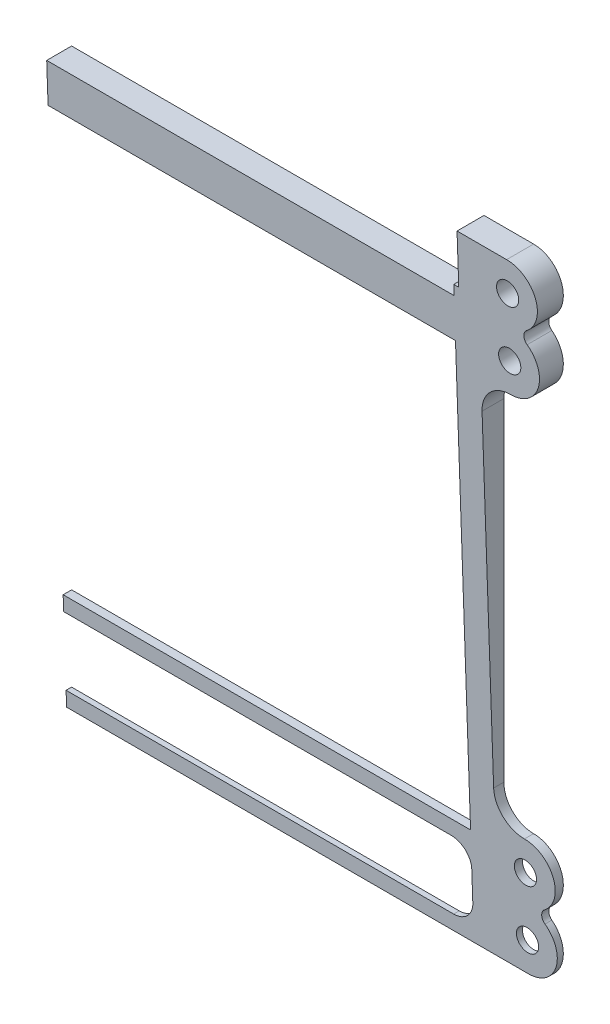
from build123d import *

# Parameters (mm, degrees)
BOSS_EXTRUDE1_OUTLINE_R = 3.556
BOSS_EXTRUDE1_OUTLINE_W = 260.9469
BOSS_EXTRUDE1_OUTLINE_H = 138.1252
BOSS_EXTRUDE1_DEPTH     = 76.2
CUT_EXTRUDE1_DEPTH      = 355.32482824
CUT_EXTRUDE1_DEPTH_BACK = 355.32482824
FILLET1_R               = 2.54
SKETCH7_W               = 260.9469
SKETCH7_H               = 22.1996
CUT_EXTRUDE2_DEPTH      = 347.152897849
FILLET2_R               = 6.35
SKETCH8_W               = 208.809057266
SKETCH8_H               = 235.521960295
CUT_EXTRUDE4_DEPTH      = 347.144751077


# Read off the part's stored shape, not the designer's step: Boss-Extrude1
with BuildPart() as part:
    # Boss-Extrude1 outline → Boss-Extrude1 (new body)
    with BuildSketch(Plane.XY):
        with BuildLine():
            Line((-286.3596, -22.225), (9.525, -22.225))
            ThreePointArc((9.525, -22.225), (19.05, -12.7), (9.525, -3.175))
            ThreePointArc((9.525, -3.175), (19.05, 6.35), (9.525, 15.875))
            ThreePointArc((9.525, 15.875), (2.789807909, 18.664807909), (0, 25.4))
            Line((0, 25.4), (0, 131.7752))
            ThreePointArc((0, 131.7752), (2.789807909, 138.510392091), (9.525, 141.3002))
            ThreePointArc((9.525, 141.3002), (19.05, 150.8252), (9.525, 160.3502))
            ThreePointArc((9.525, 160.3502), (19.05, 169.8752), (9.525, 179.4002))
            Line((9.525, 179.4002), (-6.35, 179.4002))
            Line((-6.35, 179.4002), (-6.35, 163.5252))
            Line((-6.35, 163.5252), (-7.9502, 163.5252))
            Line((-7.9502, 163.5252), (-7.9502, 160.3502))
            Line((-7.9502, 160.3502), (-268.9098, 160.3502))
            Line((-268.9098, 160.3502), (-268.9098, 163.5252))
            Line((-268.9098, 163.5252), (-270.51, 163.5252))
            Line((-270.51, 163.5252), (-270.51, 179.4002))
            Line((-270.51, 179.4002), (-286.385, 179.4002))
            ThreePointArc((-286.385, 179.4002), (-295.91, 169.8752), (-286.385, 160.3502))
            ThreePointArc((-286.385, 160.3502), (-295.897297883, 150.818850004), (-286.3723, 141.3002))
            ThreePointArc((-286.3723, 141.3002), (-279.637107909, 138.510392091), (-276.8473, 131.7752))
            Line((-276.8473, 131.7752), (-276.8473, 25.4))
            ThreePointArc((-276.8473, 25.4), (-279.637107909, 18.664807909), (-286.3723, 15.875))
            ThreePointArc((-286.3723, 15.875), (-295.8973, 6.35), (-286.3723, -3.175))
            ThreePointArc((-286.3723, -3.175), (-295.884597883, -12.706349996), (-286.3596, -22.225))
        make_face()
        with Locations((-286.3596, -12.7)):
            Circle(BOSS_EXTRUDE1_OUTLINE_R, mode=Mode.SUBTRACT)
        with Locations((-286.3723, 6.35)):
            Circle(BOSS_EXTRUDE1_OUTLINE_R, mode=Mode.SUBTRACT)
        with Locations((9.525, -12.7)):
            Circle(BOSS_EXTRUDE1_OUTLINE_R, mode=Mode.SUBTRACT)
        with Locations((9.525, 6.35)):
            Circle(BOSS_EXTRUDE1_OUTLINE_R, mode=Mode.SUBTRACT)
        with Locations((-286.3723, 150.8252)):
            Circle(BOSS_EXTRUDE1_OUTLINE_R, mode=Mode.SUBTRACT)
        with Locations((-286.385, 169.8752)):
            Circle(BOSS_EXTRUDE1_OUTLINE_R, mode=Mode.SUBTRACT)
        with Locations((-138.42365, 78.5876)):
            Rectangle(BOSS_EXTRUDE1_OUTLINE_W, BOSS_EXTRUDE1_OUTLINE_H, mode=Mode.SUBTRACT)
        with Locations((9.525, 150.8252)):
            Circle(BOSS_EXTRUDE1_OUTLINE_R, mode=Mode.SUBTRACT)
        with Locations((9.525, 169.8752)):
            Circle(BOSS_EXTRUDE1_OUTLINE_R, mode=Mode.SUBTRACT)
    extrude(amount=BOSS_EXTRUDE1_DEPTH)

    # Sketch5 → Cut-Extrude1 (cut, two sides: drawn at the far end of the back side and taken through both)
    with BuildSketch(Plane.ZY.offset(276.8473).offset(-CUT_EXTRUDE1_DEPTH_BACK)):
        Polygon((1.6002, -22.225), (8.641107133, 179.4002), (76.2, 179.4002), (76.2, -22.225), align=None)
    extrude(amount=CUT_EXTRUDE1_DEPTH + CUT_EXTRUDE1_DEPTH_BACK, mode=Mode.SUBTRACT)

    # Fillet1
    fillet1_edges = [part.edges().sort_by_distance(p)[0] for p in [
        (-286.385, 160.3502, 3.987933237),
        (-286.3723, -3.175, 1.132720329),
        (9.525, -3.175, 1.132720329),
        (9.525, 160.3502, 3.987933237),
    ]]
    fillet(fillet1_edges, radius=FILLET1_R)

    # Sketch7 → Cut-Extrude2 (cut, through all)
    with BuildSketch(Plane(origin=(0, 0, 0), x_dir=(-1, 0, 0), z_dir=(0, 0, -1))):
        with Locations((138.42365, -6.35)):
            Rectangle(SKETCH7_W, SKETCH7_H)
    extrude(amount=-CUT_EXTRUDE2_DEPTH, mode=Mode.SUBTRACT)

    # Fillet2
    fillet2_edges = [part.edges().sort_by_distance(p)[0] for p in [
        (-268.8971, 4.7498, 1.271090386),
        (-268.8971, -17.4498, 0.883476829),
        (-7.9502, -17.4498, 0.883476829),
        (-7.9502, 4.7498, 1.271090386),
    ]]
    fillet(fillet2_edges, radius=FILLET2_R)

    # Sketch8 → Cut-Extrude4 (cut, through all)
    with BuildSketch(Plane(origin=(0, -0.082881646, 2.373419811), x_dir=(1, 0, 0), z_dir=(0, -0.03489949670250444, 0.9993908270190958))):
        with Locations((-242.828178633, 74.917246318)):
            Rectangle(SKETCH8_W, SKETCH8_H)
    extrude(amount=-CUT_EXTRUDE4_DEPTH, mode=Mode.SUBTRACT)


solid = part.part
